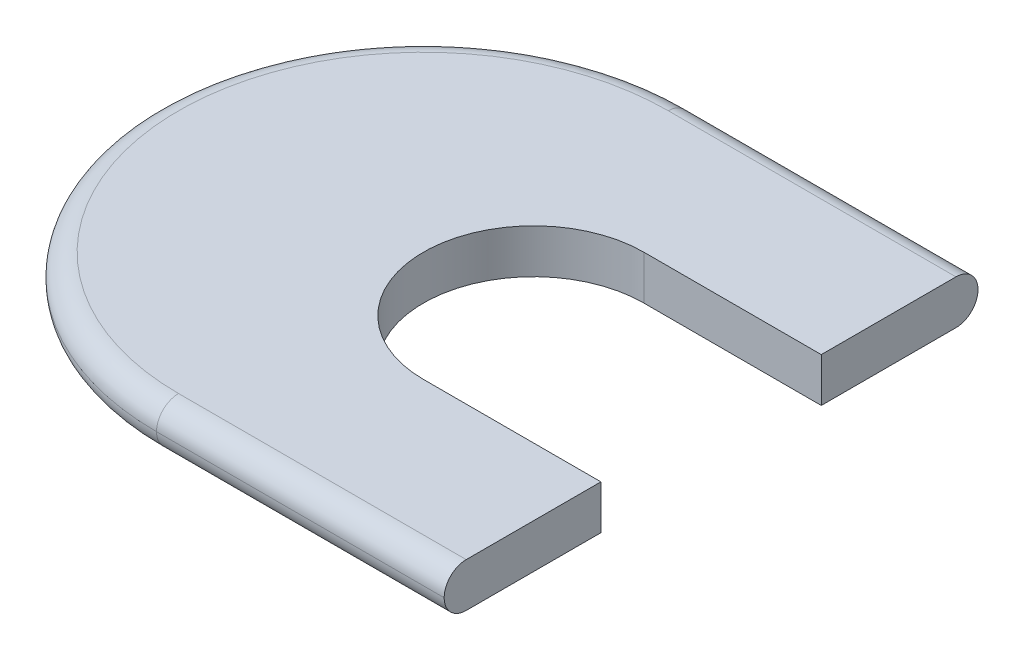
from build123d import *

# Parameters (mm, degrees)
BOSS_EXTRUDE1_DEPTH = 1
FILLET1_R           = 0.5


with BuildPart() as part:
    # Sketch1 → Boss-Extrude1 (new body)
    with BuildSketch(Plane(origin=(0, 0, 0), x_dir=(1, 0, 0), z_dir=(0, 1, 0))):
        with BuildLine():
            Line((0, 2.5), (4.026491886, 2.5))
            Line((4.026491886, 2.5), (4.026491886, 6.055714934))
            Line((4.026491886, 6.055714934), (-2.5, 6.055714934))
            ThreePointArc((-2.5, 6.055714934), (-8.555714934, 0), (-2.5, -6.055714934))
            Line((-2.5, -6.055714934), (4.026491886, -6.055714934))
            Line((4.026491886, -6.055714934), (4.026491886, -2.5))
            Line((4.026491886, -2.5), (0, -2.5))
            ThreePointArc((0, -2.5), (-2.5, 0), (0, 2.5))
        make_face()
    extrude(amount=BOSS_EXTRUDE1_DEPTH)

    # Fillet1
    fillet1_edges = [part.edges().sort_by_distance(p)[0] for p in [
        (0.763245943, 0, -6.055714934),
        (0.763245943, 0, 6.055714934),
        (0.763245943, 1, -6.055714934),
        (0.763245943, 1, 6.055714934),
        (-8.555714934, 0, 0),
        (-8.555714934, 1, 0),
    ]]
    fillet(fillet1_edges, radius=FILLET1_R - 0.0001)  # a hair under: the kernel refuses the full size


solid = part.part
